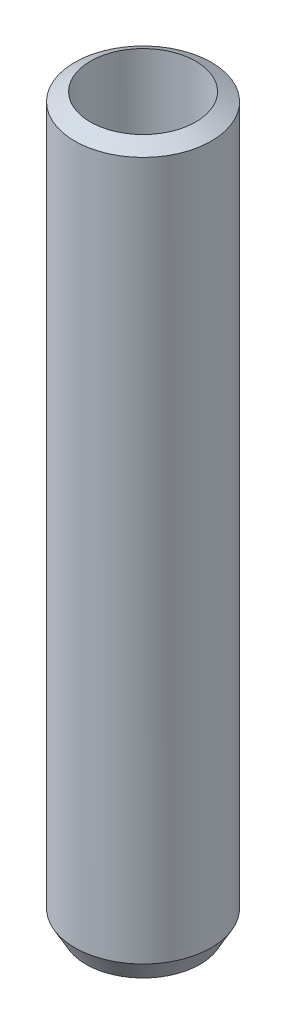
from build123d import *

# Parameters (mm, degrees)
SKETCH1_R           = 35
BOSS_EXTRUDE1_DEPTH = 374.155456
SKETCH2_R           = 27.010444237
CUT_EXTRUDE1_DEPTH  = 378.41529547
CHAMFER1_SIZE       = 5.783578
CHAMFER1_SIZE_2     = 10.29522


with BuildPart() as part:
    # Sketch1 → Boss-Extrude1 (new body)
    with BuildSketch(Plane(origin=(0, 0, 0), x_dir=(1, 0, 0), z_dir=(0, 1, 0))):
        with Locations(Location((0, 0, 0), (0, 0, 270))):
            Circle(SKETCH1_R)
    extrude(amount=BOSS_EXTRUDE1_DEPTH)

    # Sketch2 → Cut-Extrude1 (cut, through all)
    with BuildSketch(Plane(origin=(0, 0, 0), x_dir=(1, 0, 0), z_dir=(0, 1, 0))):
        with Locations(Location((0, 0, 0), (0, 0, 270))):
            Circle(SKETCH2_R)
    extrude(amount=CUT_EXTRUDE1_DEPTH, mode=Mode.SUBTRACT)

    # Chamfer1
    # the kernel refuses this chamfer: 10.29522, 5.783578 mm, written as the material it takes off along each edge
    with BuildSketch(Plane(origin=(0, 374.155456, 0), x_dir=(0, 0, 1), z_dir=(-1, 0, 0))) as chamfer1_piece_1:
        Polygon((35, -CHAMFER1_SIZE), (35 - CHAMFER1_SIZE_2, 0), (35, 0), align=None)
    revolve(axis=Axis((0, 374.155456, 0), (0, 1, 0)), mode=Mode.SUBTRACT)
    with BuildSketch(Plane(origin=(0, 0, 0), x_dir=(0, 0, 1), z_dir=(-1, 0, 0))) as chamfer1_piece_2:
        Polygon((35, CHAMFER1_SIZE_2), (35 - CHAMFER1_SIZE, 0), (35, 0), align=None)
    revolve(axis=Axis((0, 0, 0), (0, 1, 0)), mode=Mode.SUBTRACT)


solid = part.part
